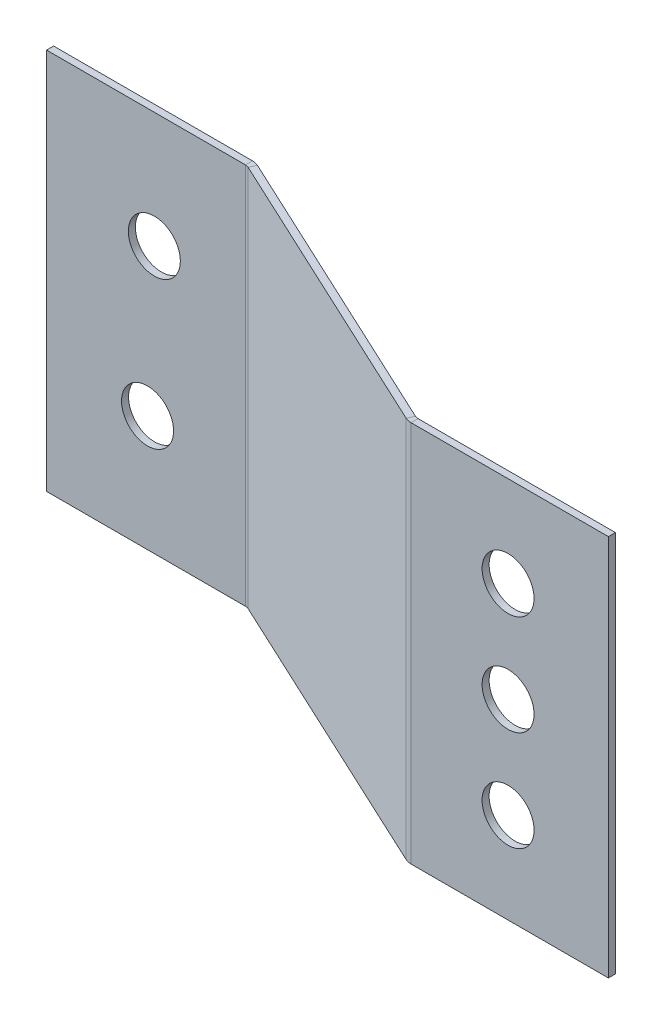
from build123d import *

# Parameters (mm, degrees)
BASE_FLANGE1_DEPTH         = 38.1
F_6_0_204_DIAMETER_HOLE1_D = 5.1816
F_6_0_204_DIAMETER_HOLE2_D = 5.1816


# Sheet-metal steps are written as plain solids
with BuildPart() as part:
    # Sketch1 → Base-Flange1 (new body)
    with BuildSketch(Plane(origin=(0, 0, 0), x_dir=(1, 0, 0), z_dir=(0, 1, 0))):
        with BuildLine():
            Line((0, 0), (-19.667225995, 0))
            ThreePointArc((-19.667225995, 0), (-19.992101306, 0.035603868), (-20.301554193, 0.14072529))
            Line((-20.301554193, 0.14072529), (-49.839171097, 13.924946512))
            ThreePointArc((-49.839171097, 13.924946512), (-50.004212637, 13.981011271), (-50.177479469, 14))
            Line((-50.177479469, 14), (-70, 14))
            Line((-70, 14), (-70, 14.7))
            Line((-70, 14.7), (-50.177479469, 14.7))
            ThreePointArc((-50.177479469, 14.7), (-49.852604159, 14.664396132), (-49.543151271, 14.55927471))
            Line((-49.543151271, 14.55927471), (-20.005534367, 0.775053488))
            ThreePointArc((-20.005534367, 0.775053488), (-19.840492827, 0.718988729), (-19.667225995, 0.7))
            Line((-19.667225995, 0.7), (0, 0.7))
            Line((0, 0.7), (0, 0))
        make_face()
    extrude(amount=BASE_FLANGE1_DEPTH)

    # #6 (0.204) Diameter Hole1 (through all)
    with Locations(Plane(origin=(0, 0, -0.7), x_dir=(-1, 0, 0), z_dir=(0, 0, -1))):
        with Locations((10, 29.05), (10, 19.05), (10, 9.05)):
            Hole(F_6_0_204_DIAMETER_HOLE1_D / 2)

    # #6 (0.204) Diameter Hole2 (through all)
    with Locations(Plane(origin=(0, 0, -14.7), x_dir=(-1, 0, 0), z_dir=(0, 0, -1))):
        with Locations((59.259333943, 26.55), (59.936433657, 11.55)):
            Hole(F_6_0_204_DIAMETER_HOLE2_D / 2)


solid = part.part
